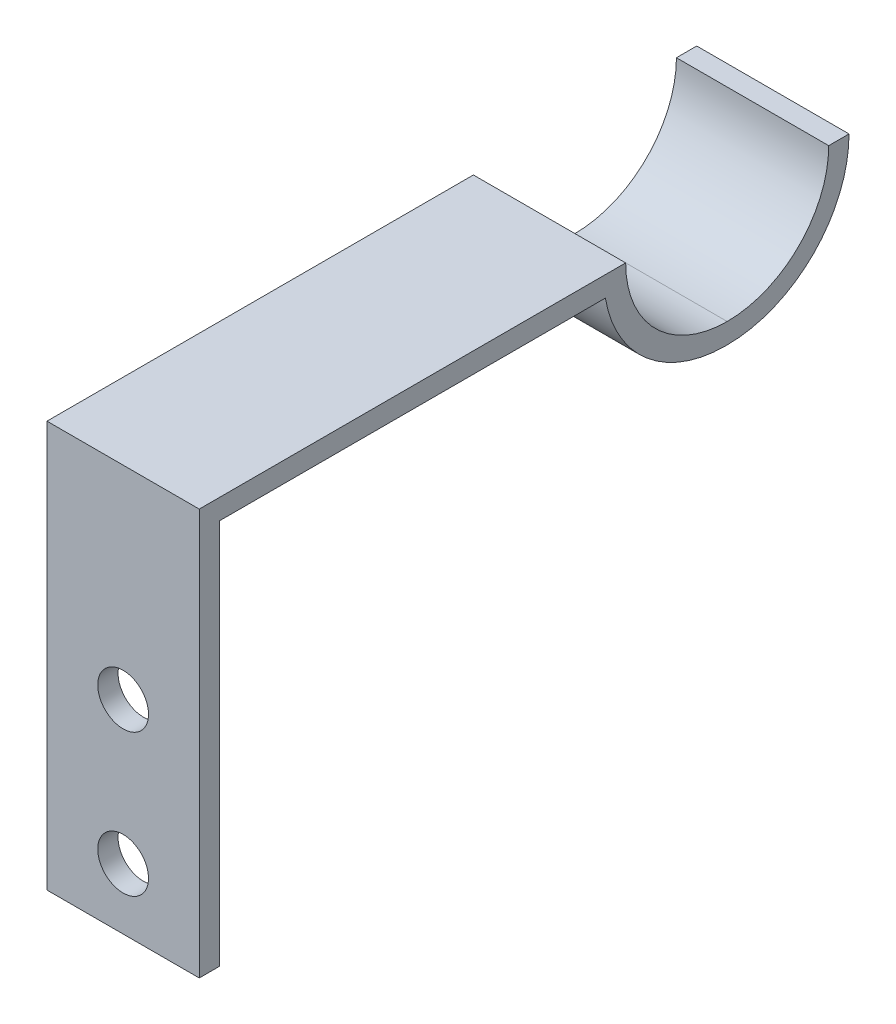
from build123d import *

# Parameters (mm, degrees)
SKETCH1_W           = 19.05
SKETCH1_H           = 50.8
SKETCH1_R           = 3.175
BOSS_EXTRUDE1_DEPTH = 2.54
SKETCH2_W           = 19.05
SKETCH2_H           = 2.54
BOSS_EXTRUDE2_DEPTH = 50.8
BOSS_EXTRUDE5_DEPTH = 19.05
FILLET6_R           = 12.7
FILLET7_R           = 15.24
FILLET11_R          = 12.7
FILLET12_R          = 15.24


# Some blends are built 0.0001 mm under size
with BuildPart() as part:
    # Sketch1 → Boss-Extrude1 (new body)
    with BuildSketch(Plane.XY):
        with Locations((-165.075387597, 33.866666667)):
            Rectangle(SKETCH1_W, SKETCH1_H)
        with Locations((-165.075387597, 16.086666667)):
            Circle(SKETCH1_R, mode=Mode.SUBTRACT)
        with Locations((-165.075387597, 33.866666667)):
            Circle(SKETCH1_R, mode=Mode.SUBTRACT)
    extrude(amount=BOSS_EXTRUDE1_DEPTH)

    # Sketch2 → Boss-Extrude2 (add)
    with BuildSketch(Plane(origin=(0, 0, 0), x_dir=(-1, 0, 0), z_dir=(0, 0, -1))):
        with Locations((165.075387597, 57.996666667)):
            Rectangle(SKETCH2_W, SKETCH2_H)
    extrude(amount=BOSS_EXTRUDE2_DEPTH)

    # Sketch4 → Boss-Extrude5 (add)
    with BuildSketch(Plane(origin=(-155.550387597, 0, 0), x_dir=(0, 0, -1), z_dir=(1, 0, 0))):
        Polygon((48.26, 56.726666667), (48.26, 44.026666667), (78.74, 44.026666667), (78.74, 59.266666667), (76.2, 59.266666667), (76.2, 46.566666667), (50.8, 46.566666667), (50.8, 56.726666667), align=None)
    extrude(amount=-BOSS_EXTRUDE5_DEPTH)

    # Fillet6
    fillet6_edges = [part.edges().sort_by_distance(p)[0] for p in [
        (-165.075387597, 46.566666667, -50.8),
    ]]
    fillet(fillet6_edges, radius=FILLET6_R - 0.0001)  # a hair under: the kernel refuses the full size

    # Fillet7
    # the kernel refuses this fillet: 15.24 mm, written as the material it takes off along each edge
    with BuildSketch(Plane(origin=(-117.983280974, 44.026666667, -48.26), x_dir=(0, 0, -1), z_dir=(-1, 0, 0))) as fillet7_piece_1:
        with BuildLine():
            CenterArc((15.026842649, -15.24), FILLET7_R, 90, 80.405931773)
            Line((0, -12.7), (-0.300536853, -12.6492))
            ThreePointArc((-0.300536853, -12.6492), (-0.3048, -6.35), (-0.3048, 0))
            Line((-0.3048, 0), (0, 0.3048))
            Line((0, 0.3048), (15.026842649, 0.3048))
            Line((15.026842649, 0.3048), (15.026842649, 0))
        make_face()
    extrude(amount=94.184213245, mode=Mode.SUBTRACT)

    # Fillet11
    fillet11_edges = [part.edges().sort_by_distance(p)[0] for p in [
        (-165.075387597, 46.566666667, -76.2),
    ]]
    fillet(fillet11_edges, radius=FILLET11_R - 0.0001)  # a hair under: the kernel refuses the full size

    # Fillet12
    fillet12_edges = [part.edges().sort_by_distance(p)[0] for p in [
        (-165.075387597, 44.026666667, -78.74),
    ]]
    fillet(fillet12_edges, radius=FILLET12_R - 0.0001)  # a hair under: the kernel refuses the full size


solid = part.part
